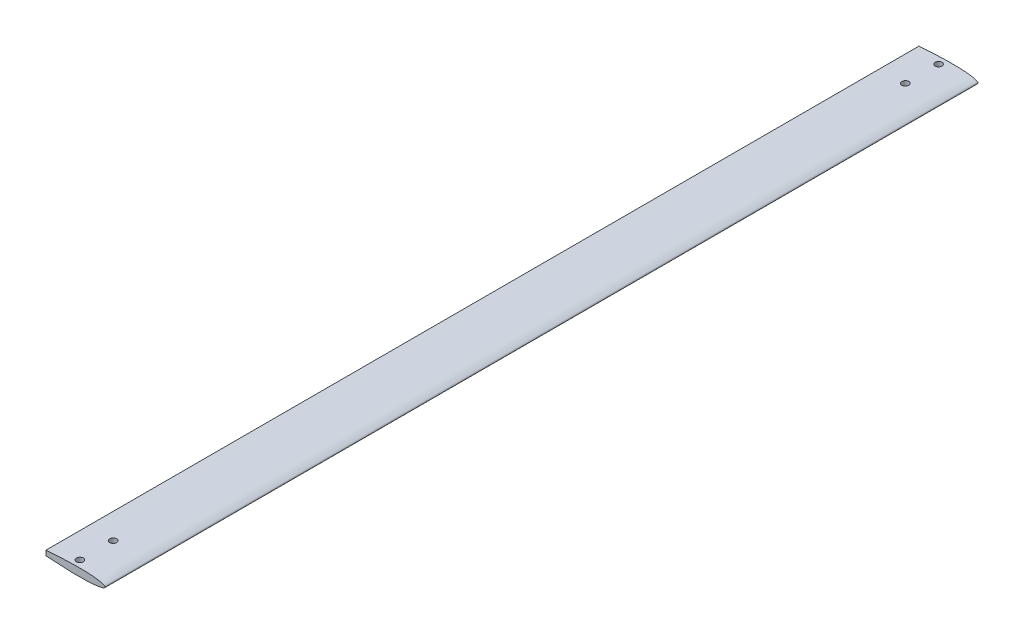
from build123d import *

# Parameters (mm, degrees)
BOSS_EXTRUDE1_DEPTH = 458.7
SKETCH2_R           = 3.6
CUT_EXTRUDE1_DEPTH  = 20


with BuildPart() as part:
    # Sketch1 → Boss-Extrude1 (new, symmetric)
    with BuildSketch(Plane.XY):
        with BuildLine():
            Line((-62.02008, 2.634524118), (-62.02008, -2.634524118))
            add(Edge.make_bspline(
                [(-62.02008, 2.634524118), (-61.245129512, 2.689936753), (-58.933941141, 2.855197684), (-55.05062946, 3.105443266), (-50.353377136, 3.383198675), (-45.603962586, 3.628038957), (-40.854507132, 3.832630365), (-36.156979397, 3.987670748), (-31.562813404, 4.084956127), (-27.122296504, 4.117208343), (-22.884032801, 4.078806595), (-18.894392408, 3.96623935), (-15.197010268, 3.778433566), (-11.832181569, 3.517038171), (-8.836604457, 3.185956278), (-6.241925947, 2.792344215), (-4.076471458, 2.342330063), (-2.356094036, 1.851380192), (-1.099199615, 1.312352738), (-0.261880265, 0.755469033), (0.108268466, 0), (-0.261880265, -0.755469033), (-1.099199615, -1.312352738), (-2.356094036, -1.851380192), (-4.076471458, -2.342330063), (-6.241925947, -2.792344215), (-8.836604457, -3.185956278), (-11.832181569, -3.517038171), (-15.197010268, -3.778433566), (-18.894392408, -3.96623935), (-22.884032801, -4.078806595), (-27.122296504, -4.117208343), (-31.562813404, -4.084956127), (-36.156979397, -3.987670748), (-40.854507132, -3.832630365), (-45.603962586, -3.628038957), (-50.353377136, -3.383198675), (-55.05062946, -3.105443266), (-58.933941141, -2.855197684), (-61.245129512, -2.689936753), (-62.02008, -2.634524118)],
                knots=[0, 0, 0, 0, 0.018499199, 0.055171439, 0.092655195, 0.130538861, 0.168407204, 0.205846372, 0.242448967, 0.277819055, 0.311576982, 0.343363918, 0.372846133, 0.39971914, 0.423712133, 0.444593591, 0.462180115, 0.476353861, 0.487105625, 0.494669113, 0.5, 0.505330887, 0.512894375, 0.523646139, 0.537819885, 0.555406409, 0.576287867, 0.60028086, 0.627153867, 0.656636082, 0.688423018, 0.722180945, 0.757551033, 0.794153628, 0.831592796, 0.869461139, 0.907344805, 0.944828561, 0.981500801, 1, 1, 1, 1], degree=3))
        make_face()
    extrude(amount=BOSS_EXTRUDE1_DEPTH, both=True)

    # Sketch2 → Cut-Extrude1 (cut)
    with BuildSketch(Plane(origin=(0, -10, 0), x_dir=(1, 0, 0), z_dir=(0, 1, 0))):
        with Locations((-33.9, -451.2)):
            Circle(SKETCH2_R)
        with Locations((-33.9, -416.2)):
            Circle(SKETCH2_R)
        with Locations((-33.9, 416.2)):
            Circle(SKETCH2_R)
        with Locations((-33.9, 451.2)):
            Circle(SKETCH2_R)
    extrude(amount=CUT_EXTRUDE1_DEPTH, mode=Mode.SUBTRACT)


solid = part.part
